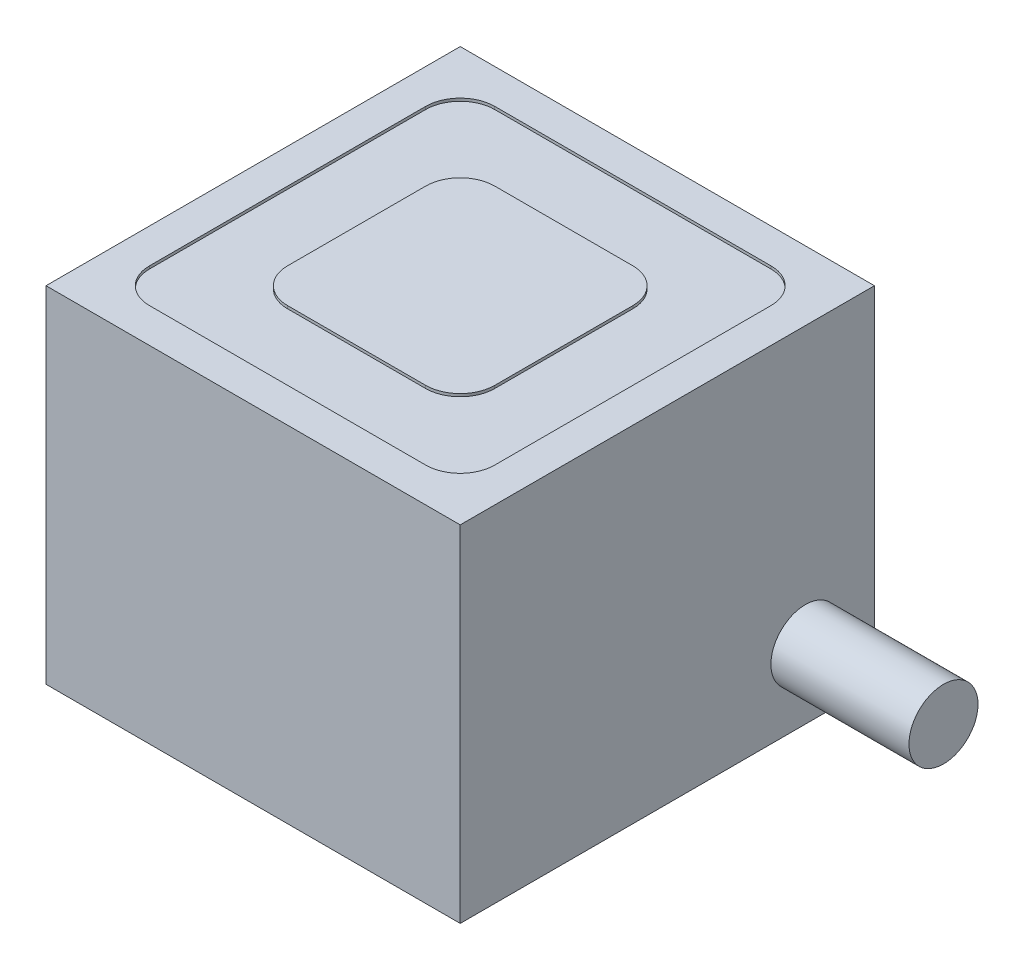
from build123d import *

# Parameters (mm, degrees)
SKETCH1_W                    = 38.1
SKETCH1_H                    = 38.1
BOSS_EXTRUDE1_DEPTH          = 31.75
CUT_EXTRUDE0_DEPTH           = 0.254
SKETCH3_R                    = 2.413
CUT_EXTRUDE1_DEPTH           = 9.525
SWEEP1_PITCH                 = 0.79375
SKETCH6_R                    = 2.498925958
CUT_EXTRUDE2_OTHER_WAY_DEPTH = 54.127911792
BOSS_EXTRUDE2_START          = 50.8
SKETCH7_R                    = 3.175
BOSS_EXTRUDE2_DEPTH          = 12.7


with BuildPart() as part:
    # Sketch1 → Boss-Extrude1 (new body)
    with BuildSketch(Plane(origin=(0, 0, 0), x_dir=(1, 0, 0), z_dir=(0, 1, 0))):
        with Locations((19.05, 0)):
            Rectangle(SKETCH1_W, SKETCH1_H)
    extrude(amount=BOSS_EXTRUDE1_DEPTH)

    # Sketch2 → Cut-Extrude0 (cut)
    with BuildSketch(Plane(origin=(0, 31.75, 0), x_dir=(1, 0, 0), z_dir=(0, 1, 0))):
        with BuildLine():
            Line((6.35, 15.875), (31.75, 15.875))
            ThreePointArc((31.75, 15.875), (33.99506403, 14.94506403), (34.925, 12.7))
            Line((34.925, 12.7), (34.925, -12.7))
            ThreePointArc((34.925, -12.7), (33.99506403, -14.94506403), (31.75, -15.875))
            Line((31.75, -15.875), (6.35, -15.875))
            ThreePointArc((6.35, -15.875), (4.10493597, -14.94506403), (3.175, -12.7))
            Line((3.175, -12.7), (3.175, 12.7))
            ThreePointArc((3.175, 12.7), (4.10493597, 14.94506403), (6.35, 15.875))
        make_face()
        with BuildLine():
            Line((12.7, 9.525), (25.4, 9.525))
            ThreePointArc((25.4, 9.525), (27.64506403, 8.59506403), (28.575, 6.35))
            Line((28.575, 6.35), (28.575, -6.35))
            ThreePointArc((28.575, -6.35), (27.64506403, -8.59506403), (25.4, -9.525))
            Line((25.4, -9.525), (12.7, -9.525))
            ThreePointArc((12.7, -9.525), (10.45493597, -8.59506403), (9.525, -6.35))
            Line((9.525, -6.35), (9.525, 6.35))
            ThreePointArc((9.525, 6.35), (10.45493597, 8.59506403), (12.7, 9.525))
        make_face(mode=Mode.SUBTRACT)
    extrude(amount=-CUT_EXTRUDE0_DEPTH, mode=Mode.SUBTRACT)

    # Sketch3 → Cut-Extrude1 (cut)
    with BuildSketch(Plane.XZ):
        with Locations(Location((19.05, 0, 0), (0, 0, 270))):
            Circle(SKETCH3_R)
    extrude(amount=-CUT_EXTRUDE1_DEPTH, mode=Mode.SUBTRACT)

    # Sweep1: the profile of Sketch5 screwed along a right-hand helix of 13 turns, 8 arcs to a turn; built about Z, then put on its axis
    sweep1_z = Axis((0, 0, 0), (0, 0, 1))
    sweep1_corners = [(2.455962979, 0, -0.719335938), (2.455962979, 0, 0.024804687), (1.98337021, 0, -0.248046875), (1.98337021, 0, -0.446484375)]
    with BuildLine(mode=Mode.PRIVATE) as sweep1_profile:
        Line(sweep1_corners[0], sweep1_corners[1])
        Line(sweep1_corners[1], sweep1_corners[2])
        Line(sweep1_corners[2], sweep1_corners[3])
        Line(sweep1_corners[3], sweep1_corners[0])
    sweep1_cap = Face(sweep1_profile.wire())
    sweep1_turn_angles = [0, 22.5, 45, 67.5, 90, 112.5, 135, 157.5, 180, 202.5, 225, 247.5, 270, 292.5, 315, 337.5, 360]
    sweep1_turn_weights = [1, 0.9238795325112867, 1, 0.9238795325112867, 1, 0.9238795325112867, 1, 0.9238795325112867, 1, 0.9238795325112867, 1, 0.9238795325112867, 1, 0.9238795325112867, 1, 0.9238795325112867, 1]
    sweep1_turn_rails = [Edge.make_bspline([Vector(p[0], p[1], 0).rotate(sweep1_z, sweep1_turn_angles[k]) / sweep1_turn_weights[k] + Vector(0, 0, p[2] + SWEEP1_PITCH * sweep1_turn_angles[k] / 360) for k in range(17)], [0, 0, 0, 1, 1, 2, 2, 3, 3, 4, 4, 5, 5, 6, 6, 7, 7, 8, 8, 8], 2, sweep1_turn_weights) for p in sweep1_corners]
    sweep1_turn_sides = [Face.make_surface_from_curves(sweep1_turn_rails[p[0]], sweep1_turn_rails[p[1]]) for p in [(0, 1), (1, 2), (2, 3), (3, 0)]]
    sweep1 = Plane(origin=(19.05, 0, 0), x_dir=(-1, 0, 0), z_dir=(0, 1, 0)) * Solid(Shell([*[p.moved(Location((0, 0, SWEEP1_PITCH * i))) for i in range(13) for p in sweep1_turn_sides], sweep1_cap, sweep1_cap.rotate(sweep1_z, 4680).moved(Location((0, 0, SWEEP1_PITCH * 4680 / 360)))]))
    add(sweep1)

    # Cut-Extrude2 cone 1 section (through the dimple's axis) → Cut-Extrude2 (revolve, cut)
    with BuildSketch(Plane(origin=(19.05, 0, 0), x_dir=(0, 0, -1), z_dir=(1, 0, 0))):
        Polygon((0, 0), (2.498925958, 0), (0, 2.498925958), align=None)
    revolve(axis=Axis((19.05, 0, 0), (0, 1, 0)), mode=Mode.SUBTRACT)

    # Sketch6 → Cut-Extrude2 other way (cut)
    with BuildSketch(Plane.XZ):
        with Locations((19.05, 0)):
            Circle(SKETCH6_R)
    extrude(amount=CUT_EXTRUDE2_OTHER_WAY_DEPTH, mode=Mode.SUBTRACT)

    # Sketch7 → Boss-Extrude2 (add)
    with BuildSketch(Plane(origin=(0, 0, 0), x_dir=(0, 0, -1), z_dir=(1, 0, 0)).offset(BOSS_EXTRUDE2_START)):
        with Locations((12.7, 6.35)):
            Circle(SKETCH7_R)
    extrude(amount=-BOSS_EXTRUDE2_DEPTH)


solid = part.part
